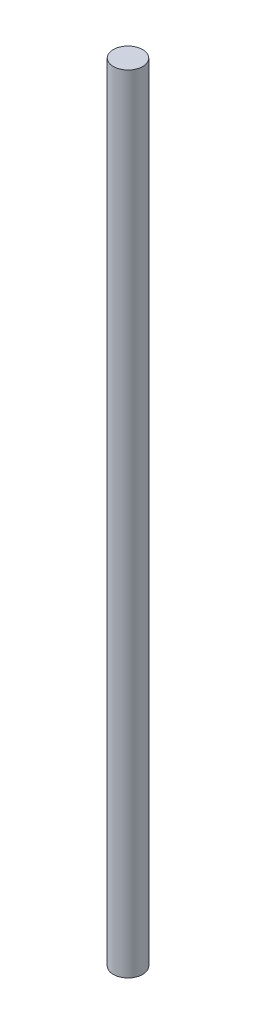
from build123d import *

# Parameters (mm, degrees)
SKETCH1_R           = 9.4996
BOSS_EXTRUDE1_DEPTH = 254


with BuildPart() as part:
    # Sketch1 → Boss-Extrude1 (new, symmetric)
    with BuildSketch(Plane(origin=(0, 0, 0), x_dir=(1, 0, 0), z_dir=(0, 1, 0))):
        Circle(SKETCH1_R)
    extrude(amount=BOSS_EXTRUDE1_DEPTH, both=True)


solid = part.part
